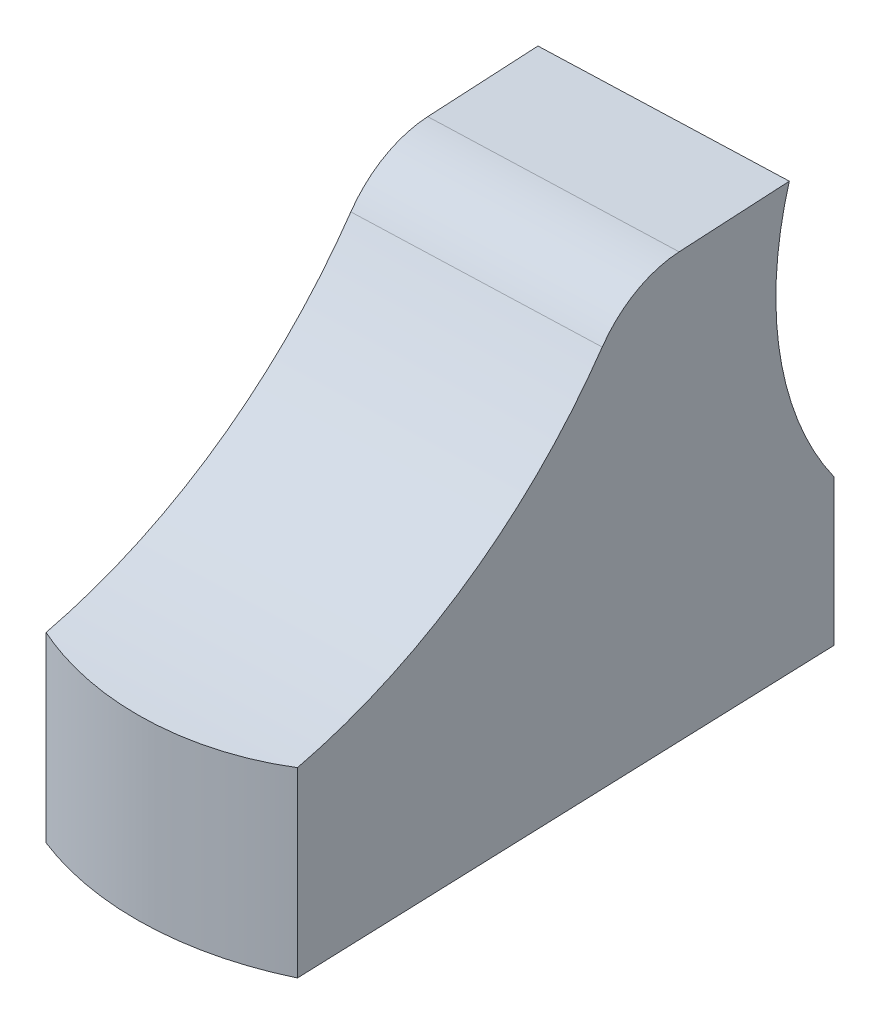
from build123d import *

# Parameters (mm, degrees)
BOSS_EXTRUDE1_DEPTH   = 17.569451358
BOSS_EXTRUDE1_START   = 17.569451358
BOSS_EXTRUDE1_2_DEPTH = 46.858135107
BOSS_EXTRUDE1_START_2 = -28.07685133
BOSS_EXTRUDE1_3_DEPTH = 23.999999999
CUT_EXTRUDE4_DEPTH    = 110
CUT_EXTRUDE5_DEPTH    = 110
SKETCH7_R             = 2.75
CUT_EXTRUDE6_DEPTH    = 11


with BuildPart() as part:
    # Boss-Extrude1: read off the stored shape, not the designer's step
    # Boss-Extrude1 outline → Boss-Extrude1 (new body)
    with BuildSketch(Plane(origin=(0, 0, 0), x_dir=(1, 0, 0), z_dir=(0, 1, 0))):
        with BuildLine():
            ThreePointArc((-24.671127501, -96.249224292), (-12.589683548, -98.325630278), (-0.686294869, -95.396110217))
            Line((-0.686294869, -95.396110217), (-2.641024782, -40.439954684))
            ThreePointArc((-2.641024782, -40.439954684), (-14.722468735, -38.363548698), (-26.625857414, -41.293068759))
            Line((-26.625857414, -41.293068759), (-24.671127501, -96.249224292))
        make_face()
    extrude(amount=BOSS_EXTRUDE1_DEPTH)

    # Boss-Extrude1 2 outline → Boss-Extrude1 2 (add)
    with BuildSketch(Plane(origin=(0, 0, 0), x_dir=(1, 0, 0), z_dir=(0, 1, 0)).offset(BOSS_EXTRUDE1_START)):
        with BuildLine():
            ThreePointArc((-2.641024782, -40.439954684), (-14.722468735, -38.363548698), (-26.625857414, -41.293068759))
            Line((-26.625857414, -41.293068759), (-24.671127501, -96.249224292))
            ThreePointArc((-24.671127501, -96.249224292), (-12.589683548, -98.325630278), (-0.686294869, -95.396110217))
            Line((-0.686294869, -95.396110217), (-2.641024782, -40.439954684))
        make_face()
    extrude(amount=BOSS_EXTRUDE1_2_DEPTH)

    # Boss-Extrude1 3 outline → Boss-Extrude1 3 (cut)
    with BuildSketch(Plane(origin=(0, 0, 0), x_dir=(0, 1, 0), z_dir=(0.9993680263239928, 0, -0.03554641980970049)).offset(BOSS_EXTRUDE1_START_2)):
        with BuildLine():
            ThreePointArc((17.569338406, 97.816751997), (33.324720821, 67.788721809), (64.427586465, 54.27848788))
            Line((64.427586465, 54.27848788), (64.427586465, 99))
            Line((64.427586465, 99), (17.39740303, 99))
            Line((17.39740303, 99), (17.569338406, 97.816751997))
        make_face()
    extrude(amount=BOSS_EXTRUDE1_3_DEPTH, mode=Mode.SUBTRACT)

    # Sketch5 → Cut-Extrude4 (cut)
    with BuildSketch(Plane(origin=(-28.0591075, 0, 0.998031544), x_dir=(0.035546419809700254, 0, 0.9993680263239927), z_dir=(-0.9993680263239927, 0, 0.035546419809700254))):
        with BuildLine():
            Line((44.891420837, 42.087012188), (56.189188936, 41.889808912))
            ThreePointArc((56.189188936, 41.889808912), (60.605735593, 40.775141371), (64.069709996, 37.817228352))
            Line((64.069709996, 37.817228352), (71.315646663, 80.984453669))
            Line((71.315646663, 80.984453669), (32.067670376, 80.984453669))
            Line((32.067670376, 80.984453669), (32.067670376, 59.188710826))
            ThreePointArc((32.067670376, 59.188710826), (39.974518446, 51.75887054), (44.891420837, 42.087012188))
        make_face()
    extrude(amount=-CUT_EXTRUDE4_DEPTH, mode=Mode.SUBTRACT)

    # Sketch6 → Cut-Extrude5 (cut)
    with BuildSketch(Plane(origin=(-28.0591075, 0, 0.998031544), x_dir=(0.035546419809700254, 0, 0.9993680263239927), z_dir=(-0.9993680263239927, 0, 0.035546419809700254))):
        with BuildLine():
            Line((27.29032593, 61.767303304), (29.792054549, 5.172444286))
            ThreePointArc((29.792054549, 5.172444286), (46.242002949, 34.252323482), (27.29032593, 61.767303304))
        make_face()
    extrude(amount=-CUT_EXTRUDE5_DEPTH, mode=Mode.SUBTRACT)

    # Sketch7 → Cut-Extrude6 (cut)
    with BuildSketch(Plane.XZ):
        with Locations(Location((-14.455870587, 45.858808896, 0), (0, 0, 270))):
            Circle(SKETCH7_R)
        with Locations(Location((-12.856281696, 90.83037008, 0), (0, 0, 270))):
            Circle(SKETCH7_R)
    extrude(amount=-CUT_EXTRUDE6_DEPTH, mode=Mode.SUBTRACT)


solid = part.part
